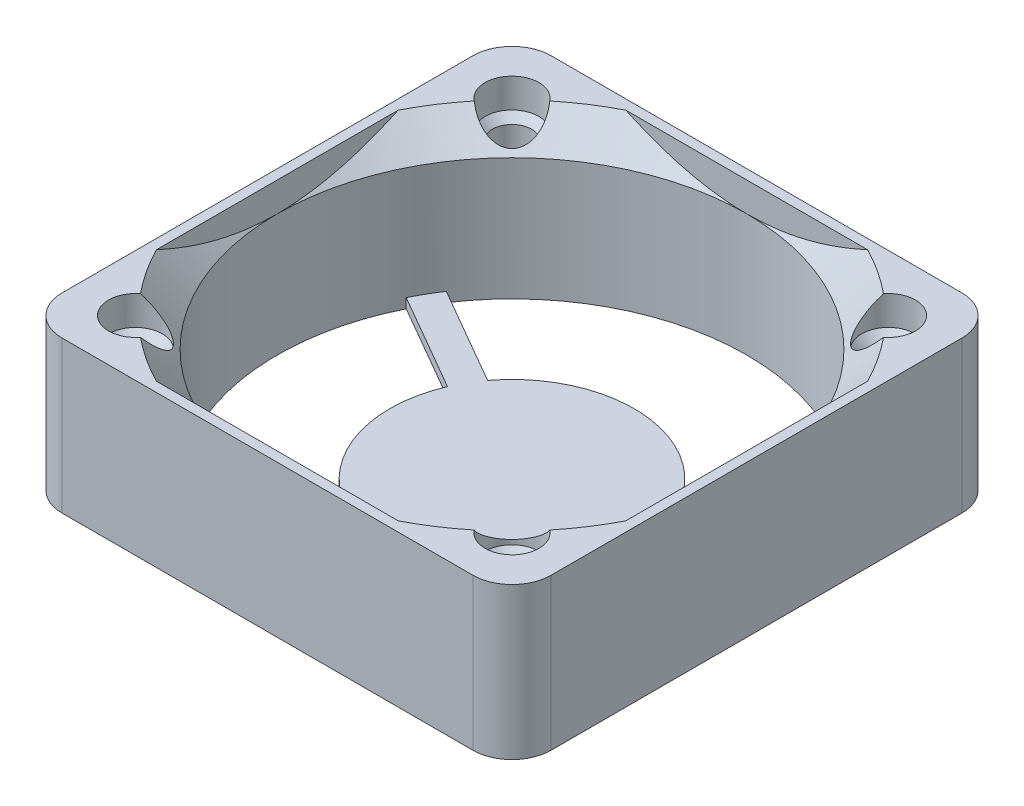
from build123d import *

# Parameters (mm, degrees)
SKETCH1_W           = 50
SKETCH1_H           = 50
SKETCH1_R           = 24
BOSS_EXTRUDE1_DEPTH = 15.5
CHAMFER1_SIZE       = 3
SKETCH4_W           = 50
SKETCH4_H           = 50
SKETCH4_W_2         = 48
SKETCH4_H_2         = 48
BOSS_EXTRUDE2_DEPTH = 15.5
SKETCH5_R           = 2.75
CUT_EXTRUDE1_DEPTH  = 3
FILLET1_R           = 4
SKETCH6_R           = 12.5
BOSS_EXTRUDE5_DEPTH = 1
SKETCH7_R           = 2
CUT_EXTRUDE2_DEPTH  = 21
CHAMFER3_SIZE       = 0.75
SKETCH9_W           = 3
SKETCH9_H           = 24
BOSS_EXTRUDE6_DEPTH = 1
CIRPATTERN1_COUNT   = 3


# Some blends are built 0.0001 mm under size
with BuildPart() as part:
    # Sketch1 → Boss-Extrude1 (new body)
    with BuildSketch(Plane(origin=(0, 0, 0), x_dir=(1, 0, 0), z_dir=(0, 1, 0))):
        Rectangle(SKETCH1_W, SKETCH1_H)
        with Locations(Location((0, 0, 0), (0, 0, 270))):
            Circle(SKETCH1_R, mode=Mode.SUBTRACT)
    extrude(amount=BOSS_EXTRUDE1_DEPTH)

    # Chamfer1
    # the kernel refuses this chamfer: 3 mm, written as the material it takes off along each edge
    with BuildSketch(Plane(origin=(0, 15.5, 0), x_dir=(0, 0, 1), z_dir=(-1, 0, 0))) as chamfer1_piece_1:
        Polygon((24, -CHAMFER1_SIZE), (24 + CHAMFER1_SIZE, 0), (24, 0), align=None)
    revolve(axis=Axis((0, 15.5, 0), (0, 1, 0)), mode=Mode.SUBTRACT)

    # Sketch4 → Boss-Extrude2 (add)
    with BuildSketch(Plane(origin=(0, 15.5, 0), x_dir=(1, 0, 0), z_dir=(0, 1, 0))):
        Rectangle(SKETCH4_W, SKETCH4_H)
        Rectangle(SKETCH4_W_2, SKETCH4_H_2, mode=Mode.SUBTRACT)
    extrude(amount=-BOSS_EXTRUDE2_DEPTH)

    # Sketch5 → Cut-Extrude1 (cut)
    with BuildSketch(Plane(origin=(0, 15.5, 0), x_dir=(1, 0, 0), z_dir=(0, 1, 0))):
        with Locations(Location((-19.25, 19.25, 0), (0, 0, 270))):
            Circle(SKETCH5_R)
        with Locations(Location((19.25, 19.25, 0), (0, 0, 270))):
            Circle(SKETCH5_R)
        with Locations(Location((19.25, -19.25, 0), (0, 0, 270))):
            Circle(SKETCH5_R)
        with Locations(Location((-19.25, -19.25, 0), (0, 0, 270))):
            Circle(SKETCH5_R)
    extrude(amount=-CUT_EXTRUDE1_DEPTH, mode=Mode.SUBTRACT)

    # Fillet1
    fillet1_edges = [part.edges().sort_by_distance(p)[0] for p in [
        (-25, 7.75, -25),
        (25, 7.75, -25),
        (25, 7.75, 25),
        (-25, 7.75, 25),
    ]]
    fillet(fillet1_edges, radius=FILLET1_R)

    # Sketch7 → Cut-Extrude2 (cut)
    with BuildSketch(Plane(origin=(0, 12.5, 0), x_dir=(1, 0, 0), z_dir=(0, 1, 0))):
        with Locations(Location((-19.25, 19.25, 0), (0, 0, 270))):
            Circle(SKETCH7_R)
        with Locations(Location((-19.25, -19.25, 0), (0, 0, 270))):
            Circle(SKETCH7_R)
        with Locations(Location((19.25, -19.25, 0), (0, 0, 270))):
            Circle(SKETCH7_R)
        with Locations(Location((19.25, 19.25, 0), (0, 0, 270))):
            Circle(SKETCH7_R)
    extrude(amount=-CUT_EXTRUDE2_DEPTH, mode=Mode.SUBTRACT)

    # Chamfer3
    chamfer3_edges = [part.edges().sort_by_distance(p)[0] for p in [
        (-19.25, 12.5, -21.25),
        (-19.25, 12.5, 17.25),
        (19.25, 12.5, 17.25),
        (19.25, 12.5, -21.25),
    ]]
    chamfer(chamfer3_edges, length=CHAMFER3_SIZE - 0.0001)  # a hair under: the kernel refuses the full size



with BuildPart() as body_2:
    # Sketch6 → Boss-Extrude5 (new body)
    with BuildSketch(Plane(origin=(0, 0, 0), x_dir=(1, 0, 0), z_dir=(0, 1, 0))):
        with Locations(Location((0, 0, 0), (0, 0, 270))):
            Circle(SKETCH6_R)
    extrude(amount=BOSS_EXTRUDE5_DEPTH)


with BuildPart() as part_1:
    add(part.part)

    add(body_2.part)  # Boss-Extrude6 merges body 2
    # Sketch9 → Boss-Extrude6 (add)
    with BuildSketch(Plane.XZ):
        with Locations((0, 12.5)):
            Rectangle(SKETCH9_W, SKETCH9_H)
    boss_extrude6 = extrude(amount=-BOSS_EXTRUDE6_DEPTH)

    # CirPattern1: Boss-Extrude6 ×3 about axis
    cirpattern1_axis = Axis((0, 0, 0), (0, 1, 0))
    for i in range(1, CIRPATTERN1_COUNT):
        add(boss_extrude6.rotate(cirpattern1_axis, i * 360 / CIRPATTERN1_COUNT))


solid = part_1.part
